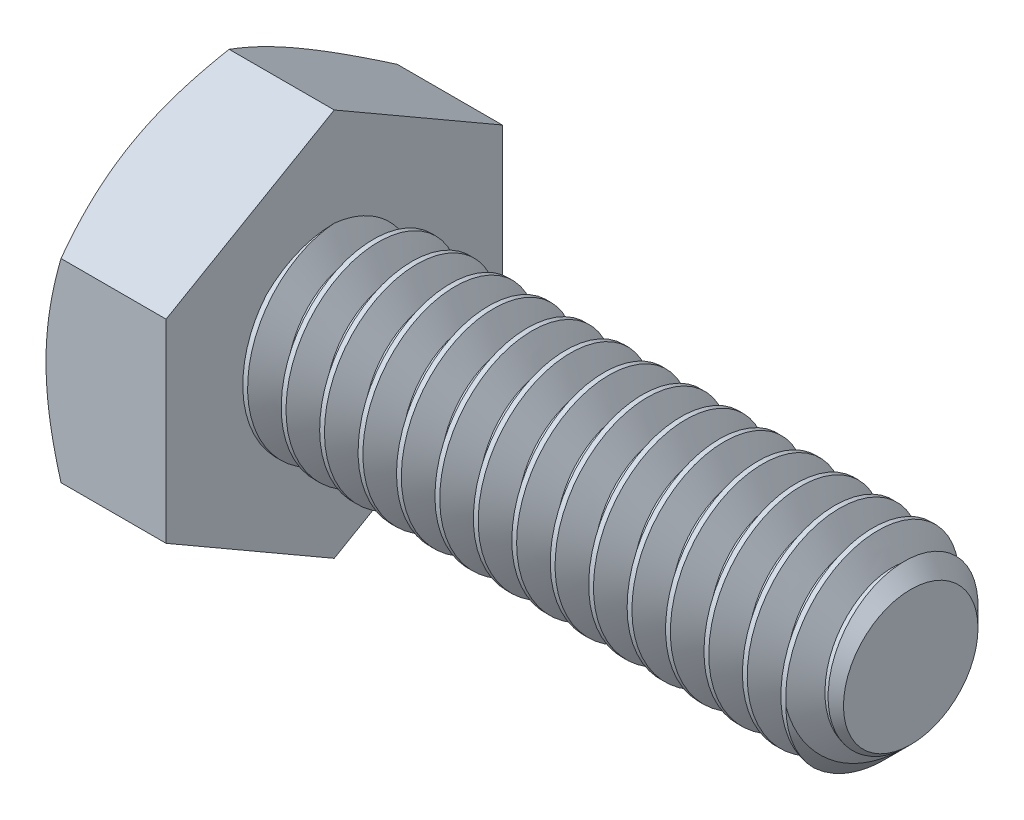
from build123d import *

# Parameters (mm, degrees)
SKETCH5_R           = 3.175
BOSS_EXTRUDE3_DEPTH = 19.05
CHAMFER1_SIZE       = 0.9525
BOSS_EXTRUDE4_DEPTH = 3.96875
SKETCH8_OUTSIDE_W   = 107.284
SKETCH8_OUTSIDE_H   = 109.004
SKETCH8_OUTSIDE_R   = 5.55625
CUT_EXTRUDE3_DEPTH  = 25.533595695
CUT_EXTRUDE3_DRAFT  = -60
CUT_EXTRUDE4_DEPTH  = 0.254
CIRPATTERN1_COUNT   = 6
CUT_SWEEP2_PITCH    = 1.27
CUT_SWEEP2_TO       = 19.05
SKETCH14_R          = 3.175
BOSS_EXTRUDE5_DEPTH = 3.71475


with BuildPart() as part:
    # Sketch5 → Boss-Extrude3 (new body)
    with BuildSketch(Plane(origin=(11.509375, 0, 0), x_dir=(0, 0, -1), z_dir=(1, 0, 0))):
        Circle(SKETCH5_R)
    extrude(amount=-BOSS_EXTRUDE3_DEPTH)

    # Chamfer1
    chamfer1_edges = [part.edges().sort_by_distance(p)[0] for p in [
        (11.509375, 0, 3.175),
    ]]
    chamfer(chamfer1_edges, length=CHAMFER1_SIZE)

    # Sketch6 → Boss-Extrude4 (add)
    with BuildSketch(Plane.ZY.offset(7.540625)):
        Polygon((5.55625, 3.207902433), (0, 6.415804866), (-5.55625, 3.207902433), (-5.55625, -3.207902433), (0, -6.415804866), (5.55625, -3.207902433), align=None)
    extrude(amount=BOSS_EXTRUDE4_DEPTH)


with BuildPart() as cut_extrude3_tool:
    # Sketch8 outside → Cut-Extrude3 (with draft: the straight prism first)
    with BuildSketch(Plane.ZY.offset(11.509375)):
        Rectangle(SKETCH8_OUTSIDE_W, SKETCH8_OUTSIDE_H)
        Circle(SKETCH8_OUTSIDE_R, mode=Mode.SUBTRACT)
    extrude(amount=-CUT_EXTRUDE3_DEPTH)
    # Cut-Extrude3: the draft: its side faces are tilted about the plane it starts from
    cut_extrude3_sides = [cut_extrude3_tool.faces().sort_by_distance(p)[0] for p in [
        (1.257422847, -54.502, 0),
        (1.257422847, 0, 53.642),
        (1.257422847, 54.502, 0),
        (1.257422847, 0, -53.642),
        (1.257422847, 0, -5.55625),
    ]]
    draft(cut_extrude3_sides, Plane.ZY.offset(11.509375), CUT_EXTRUDE3_DRAFT)


with BuildPart() as part_1:
    add(part.part)

    # Cut-Extrude3: cut by cut_extrude3_tool
    add(cut_extrude3_tool.part, mode=Mode.SUBTRACT)

    # Sketch12 → Cut-Extrude4 (cut)
    with BuildSketch(Plane.ZY.offset(11.509375)):
        with BuildLine():
            Line((0.1666875, 4.2783125), (0.1666875, 2.3891875))
            ThreePointArc((0.1666875, 2.3891875), (0, 2.2225), (-0.1666875, 2.3891875))
            Line((-0.1666875, 2.3891875), (-0.1666875, 4.2783125))
            ThreePointArc((-0.1666875, 4.2783125), (0, 4.445), (0.1666875, 4.2783125))
        make_face()
    cut_extrude4 = extrude(amount=-CUT_EXTRUDE4_DEPTH, mode=Mode.SUBTRACT)

    # CirPattern1: Cut-Extrude4 ×6 about axis
    cirpattern1_axis = Axis((0, 0, 0), (1, 0, 0))
    for i in range(1, CIRPATTERN1_COUNT):
        add(cut_extrude4.rotate(cirpattern1_axis, i * 360 / CIRPATTERN1_COUNT), mode=Mode.SUBTRACT)


with BuildPart() as body_2:
    # Split1: read off the stored shape, not the designer's step
    # Split1: the piece on the far side of the plane
    add(part_1.part)
    split(bisect_by=Plane.YZ.offset(-7.540625), keep=Keep.BOTTOM)


with BuildPart() as part_2:
    add(part_1.part)

    # Split1
    split(bisect_by=Plane.YZ.offset(-7.540625), keep=Keep.TOP)

    # Cut-Sweep2: arcs per turn and ends read off the stored shape
    # Cut-Sweep2: the profile of Sketch10 screwed along a right-hand helix through 16 turns, 8 arcs to a turn; built about Z, then put on its axis
    cut_sweep2_z = Axis((0, 0, 0), (0, 0, 1))
    cut_sweep2_corners = [(3.175, 0, 0), (2.350110803, 0, -0.47625), (2.350110803, 0, -0.635), (3.175, 0, -1.11125), (3.2004, 0, -1.125914697), (3.2004, 0, 0.014664697)]
    with BuildLine(mode=Mode.PRIVATE) as cut_sweep2_profile:
        Line(cut_sweep2_corners[0], cut_sweep2_corners[1])
        Line(cut_sweep2_corners[1], cut_sweep2_corners[2])
        Line(cut_sweep2_corners[2], cut_sweep2_corners[3])
        Line(cut_sweep2_corners[3], cut_sweep2_corners[4])
        Line(cut_sweep2_corners[4], cut_sweep2_corners[5])
        Line(cut_sweep2_corners[5], cut_sweep2_corners[0])
    cut_sweep2_cap = Face(cut_sweep2_profile.wire())
    cut_sweep2_turn_angles = [0, 22.5, 45, 67.5, 90, 112.5, 135, 157.5, 180, 202.5, 225, 247.5, 270, 292.5, 315, 337.5, 360]
    cut_sweep2_turn_weights = [1, 0.9238795325112867, 1, 0.9238795325112867, 1, 0.9238795325112867, 1, 0.9238795325112867, 1, 0.9238795325112867, 1, 0.9238795325112867, 1, 0.9238795325112867, 1, 0.9238795325112867, 1]
    cut_sweep2_turn_rails = [Edge.make_bspline([Vector(p[0], p[1], 0).rotate(cut_sweep2_z, cut_sweep2_turn_angles[k]) / cut_sweep2_turn_weights[k] + Vector(0, 0, p[2] + CUT_SWEEP2_PITCH * cut_sweep2_turn_angles[k] / 360) for k in range(17)], [0, 0, 0, 1, 1, 2, 2, 3, 3, 4, 4, 5, 5, 6, 6, 7, 7, 8, 8, 8], 2, cut_sweep2_turn_weights) for p in cut_sweep2_corners]
    cut_sweep2_turn_sides = [Face.make_surface_from_curves(cut_sweep2_turn_rails[p[0]], cut_sweep2_turn_rails[p[1]]) for p in [(0, 1), (1, 2), (2, 3), (3, 4), (4, 5), (5, 0)]]
    cut_sweep2 = Plane(origin=(11.509375, 0, 0), x_dir=(0, 1, 0), z_dir=(-1, 0, 0)) * split(Solid(Shell([*[p.moved(Location((0, 0, CUT_SWEEP2_PITCH * i))) for i in range(16) for p in cut_sweep2_turn_sides], cut_sweep2_cap, cut_sweep2_cap.rotate(cut_sweep2_z, 5760).moved(Location((0, 0, CUT_SWEEP2_PITCH * 5760 / 360)))])), bisect_by=Plane.XY.offset(CUT_SWEEP2_TO), keep=Keep.BOTTOM, mode=Mode.PRIVATE)
    add(cut_sweep2, mode=Mode.SUBTRACT)

    add(body_2.part)  # Boss-Extrude5 merges body 2
    # Sketch14 → Boss-Extrude5 (add)
    with BuildSketch(Plane(origin=(-7.540625, 0, 0), x_dir=(0, 0, -1), z_dir=(1, 0, 0))):
        Circle(SKETCH14_R)
    extrude(amount=-BOSS_EXTRUDE5_DEPTH)


solid = part_2.part
